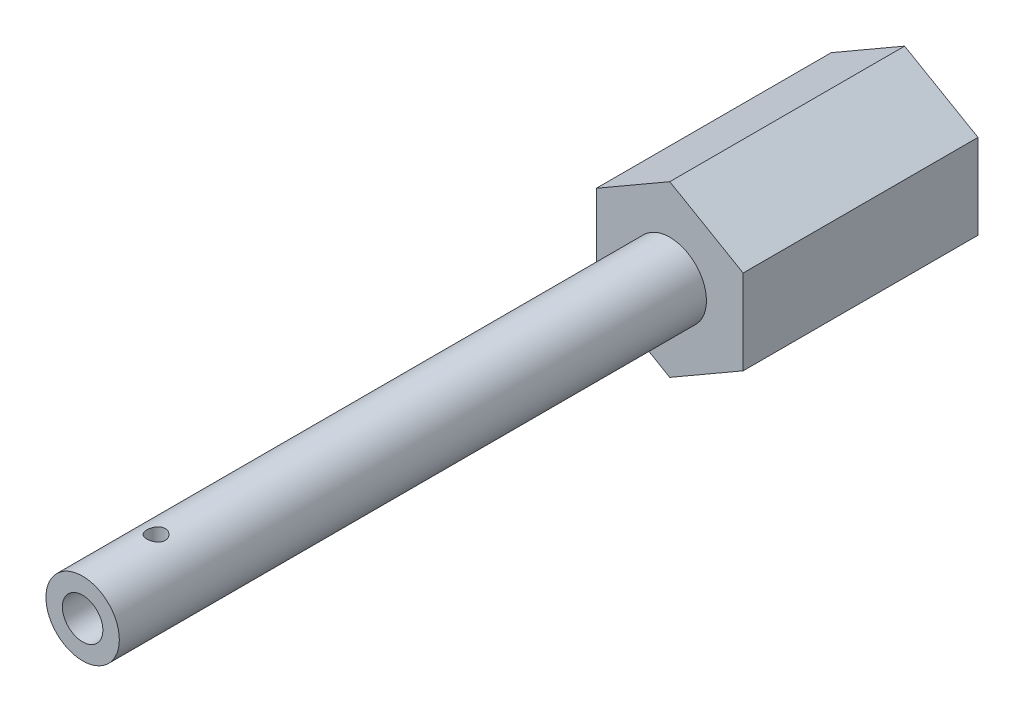
from build123d import *

# Parameters (mm, degrees)
BOSS_EXTRUDE1_DEPTH            = 20.32
SKETCH2_R                      = 3.175
BOSS_EXTRUDE2_DEPTH            = 50.8
F_3_5_3_5_DIAMETER_HOLE1_D     = 3.5
F_3_5_3_5_DIAMETER_HOLE1_DEPTH = 25.4
F_3_5_3_5_DIAMETER_HOLE1_TIP   = 1.051506083
F_1_16_0_0625_DIAMETER_HOLE1_D = 1.5875


with BuildPart() as part:
    # Sketch1 → Boss-Extrude1 (new body)
    with BuildSketch(Plane.XY):
        Polygon((0, 7.332348419), (-6.35, 3.666174209), (-6.35, -3.666174209), (0, -7.332348419), (6.35, -3.666174209), (6.35, 3.666174209), align=None)
    extrude(amount=BOSS_EXTRUDE1_DEPTH)

    # Sketch2 → Boss-Extrude2 (add)
    with BuildSketch(Plane.XY.offset(20.32)):
        Circle(SKETCH2_R)
    extrude(amount=BOSS_EXTRUDE2_DEPTH)

    # Ø3.5 (3.5) Diameter Hole1
    with Locations(Plane.XY.offset(71.12)):
        with Locations((0, 0)):
            Hole(F_3_5_3_5_DIAMETER_HOLE1_D / 2, depth=F_3_5_3_5_DIAMETER_HOLE1_DEPTH)
            with Locations((0, 0, -(F_3_5_3_5_DIAMETER_HOLE1_DEPTH + F_3_5_3_5_DIAMETER_HOLE1_TIP / 2))):  # 118° drill point
                Cone(0, F_3_5_3_5_DIAMETER_HOLE1_D / 2, F_3_5_3_5_DIAMETER_HOLE1_TIP, mode=Mode.SUBTRACT)

    # 1/16 (0.0625) Diameter Hole1 (through all)
    with Locations(Plane(origin=(0, 7.62, 0), x_dir=(1, 0, 0), z_dir=(0, 1, 0))):
        with Locations((0, -64.77)):
            Hole(F_1_16_0_0625_DIAMETER_HOLE1_D / 2)


solid = part.part
